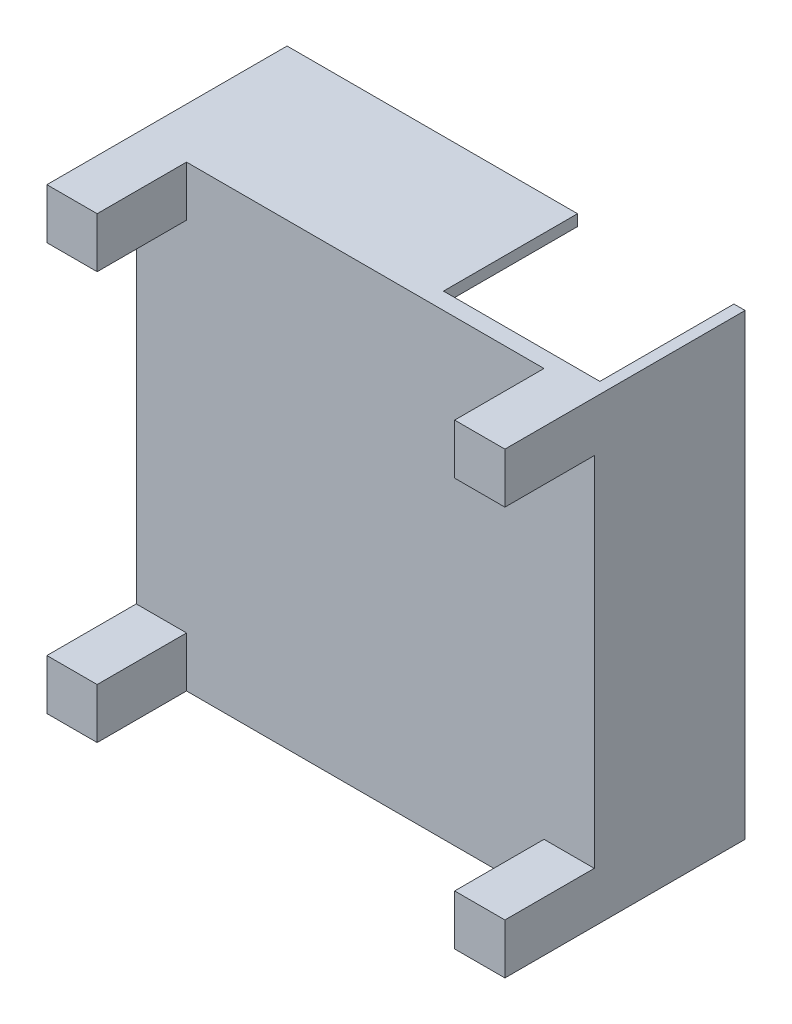
from build123d import *

# Parameters (mm, degrees)
SCHIZZO1_W                   = 41
SCHIZZO1_H                   = 41
ESTRUSIONE_ESTRUSIONE1_DEPTH = 1.5
SCHIZZO5_W                   = 4.5
SCHIZZO5_H                   = 4.5
ESTRUSIONE_ESTRUSIONE2_DEPTH = 8
SCHIZZO6_W                   = 4.5
SCHIZZO6_H                   = 4.5
ESTRUSIONE_ESTRUSIONE3_DEPTH = 8
SCHIZZO7_W                   = 4.5
SCHIZZO7_H                   = 4.5
ESTRUSIONE_ESTRUSIONE4_DEPTH = 8
SCHIZZO8_W                   = 4.5
SCHIZZO8_H                   = 4.5
ESTRUSIONE_ESTRUSIONE5_DEPTH = 8
SCHIZZO9_W                   = 1
SCHIZZO9_H                   = 41
ESTRUSIONE_ESTRUSIONE6_DEPTH = 12
SCHIZZO10_W                  = 26
SCHIZZO10_H                  = 1
ESTRUSIONE_ESTRUSIONE7_DEPTH = 12


with BuildPart() as part:
    # Schizzo1 → Estrusione-Estrusione1 (new body)
    with BuildSketch(Plane.XY):
        with Locations((20.5, 20.5)):
            Rectangle(SCHIZZO1_W, SCHIZZO1_H)
    extrude(amount=ESTRUSIONE_ESTRUSIONE1_DEPTH)

    # Schizzo5 → Estrusione-Estrusione2 (add)
    with BuildSketch(Plane.XY.offset(1.5)):
        with Locations((2.25, 2.25)):
            Rectangle(SCHIZZO5_W, SCHIZZO5_H)
    extrude(amount=ESTRUSIONE_ESTRUSIONE2_DEPTH)

    # Schizzo6 → Estrusione-Estrusione3 (add)
    with BuildSketch(Plane.XY.offset(1.5)):
        with Locations((38.75, 2.25)):
            Rectangle(SCHIZZO6_W, SCHIZZO6_H)
    extrude(amount=ESTRUSIONE_ESTRUSIONE3_DEPTH)

    # Schizzo7 → Estrusione-Estrusione4 (add)
    with BuildSketch(Plane.XY.offset(1.5)):
        with Locations((2.25, 38.75)):
            Rectangle(SCHIZZO7_W, SCHIZZO7_H)
    extrude(amount=ESTRUSIONE_ESTRUSIONE4_DEPTH)

    # Schizzo8 → Estrusione-Estrusione5 (add)
    with BuildSketch(Plane.XY.offset(1.5)):
        with Locations((38.75, 38.75)):
            Rectangle(SCHIZZO8_W, SCHIZZO8_H)
    extrude(amount=ESTRUSIONE_ESTRUSIONE5_DEPTH)

    # Schizzo9 → Estrusione-Estrusione6 (add)
    with BuildSketch(Plane(origin=(0, 0, 0), x_dir=(-1, 0, 0), z_dir=(0, 0, -1))):
        with Locations((-40.5, 20.5)):
            Rectangle(SCHIZZO9_W, SCHIZZO9_H)
    extrude(amount=ESTRUSIONE_ESTRUSIONE6_DEPTH)

    # Schizzo10 → Estrusione-Estrusione7 (add)
    with BuildSketch(Plane(origin=(0, 0, 0), x_dir=(-1, 0, 0), z_dir=(0, 0, -1))):
        with Locations((-13, 40.5)):
            Rectangle(SCHIZZO10_W, SCHIZZO10_H)
    extrude(amount=ESTRUSIONE_ESTRUSIONE7_DEPTH)


solid = part.part
